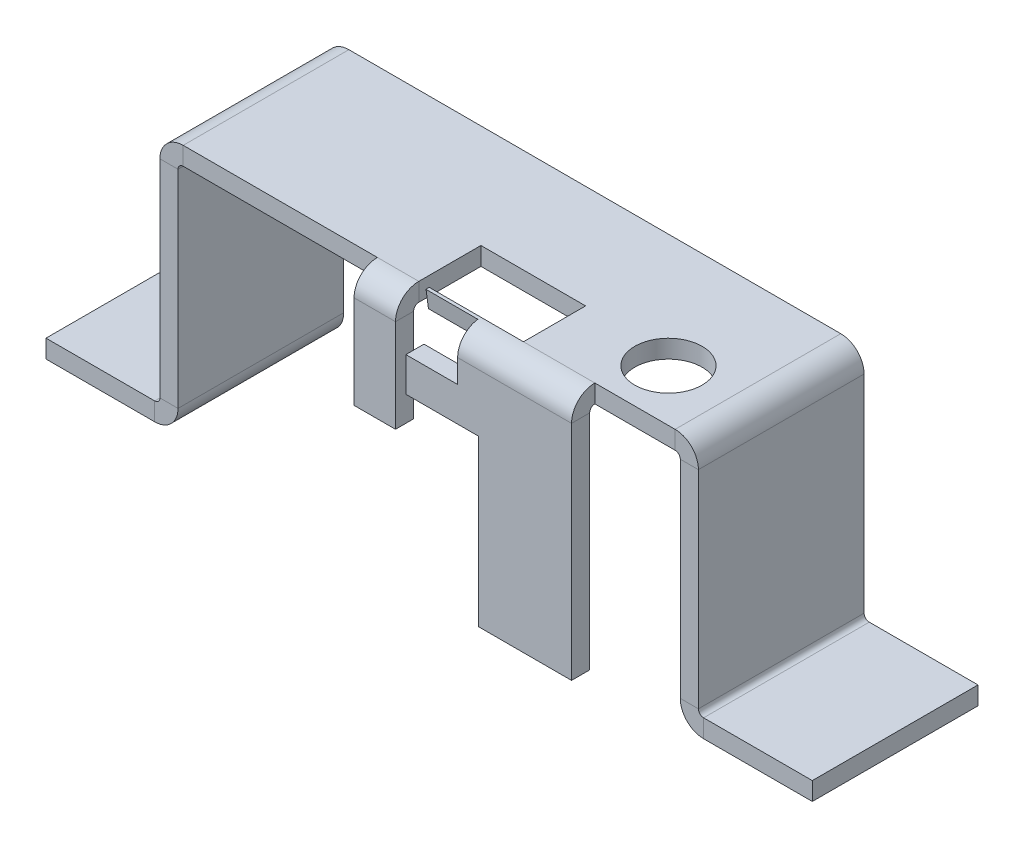
from build123d import *

# Parameters (mm, degrees)
SKETCH1_W               = 95
SKETCH1_H               = 32
BASE_FLANGE1_DEPTH      = 3.5
EDGE_FLANGE1_DEPTH      = 32
EDGE_FLANGE1_BEND_DEPTH = 32
EDGE_FLANGE2_DEPTH      = 32
EDGE_FLANGE2_BEND_DEPTH = 32
EDGE_FLANGE3_DEPTH      = 8
EDGE_FLANGE4_DEPTH      = 32
SKETCH30_R              = 6.5
SKETCH30_R_2            = 4
SKETCH30_W              = 20.215069336
SKETCH30_H              = 12
CUT_EXTRUDE1_DEPTH      = 10
CUT_EXTRUDE2_OUTLINE_W  = 31.867862703
CUT_EXTRUDE2_OUTLINE_H  = 3.5
CUT_EXTRUDE2_DEPTH      = 14
CUT_EXTRUDE2_2_DEPTH    = 10


# Read off the part's stored shape, not the designer's step: Cut-Extrude2
# Sheet-metal steps are written as plain solids
with BuildPart() as part:
    # Sketch1 → Base-Flange1 (new body)
    with BuildSketch(Plane(origin=(0, 0, 0), x_dir=(1, 0, 0), z_dir=(0, 1, 0))):
        Rectangle(SKETCH1_W, SKETCH1_H)
    extrude(amount=-BASE_FLANGE1_DEPTH)

    # Edge-Flange1 section (across the edge) → Edge-Flange1 (add)
    with BuildSketch(Plane(origin=(48.5, -3.5, -16), x_dir=(-1, 0, 0), z_dir=(0, 0, 1))):
        with BuildLine():
            Line((-3.5, 1), (-3.5, 41))
            Line((-3.5, 41), (0, 41))
            Line((0, 41), (0, 1))
            ThreePointArc((0, 1), (0.292893219, 0.292893219), (1, 0))
            Line((1, 0), (1, -3.5))
            ThreePointArc((1, -3.5), (-2.181980515, -2.181980515), (-3.5, 1))
        make_face()
    extrude(amount=EDGE_FLANGE1_DEPTH)

    # Edge-Flange1 section 2 (across the edge) → Edge-Flange1 bend (add)
    with BuildSketch(Plane(origin=(-48.5, -3.5, 16), x_dir=(1, 0, 0), z_dir=(0, 0, -1))):
        with BuildLine():
            Line((-3.5, 1), (-3.5, 41))
            Line((-3.5, 41), (0, 41))
            Line((0, 41), (0, 1))
            ThreePointArc((0, 1), (0.292893219, 0.292893219), (1, 0))
            Line((1, 0), (1, -3.5))
            ThreePointArc((1, -3.5), (-2.181980515, -2.181980515), (-3.5, 1))
        make_face()
    extrude(amount=EDGE_FLANGE1_BEND_DEPTH)

    # Edge-Flange2 section (across the edge) → Edge-Flange2 (add)
    with BuildSketch(Plane(origin=(52, -45.5, 16), x_dir=(0, 1, 0), z_dir=(0, 0, -1))):
        with BuildLine():
            Line((-3.5, 1), (-3.5, 22))
            Line((-3.5, 22), (0, 22))
            Line((0, 22), (0, 1))
            ThreePointArc((0, 1), (0.292893219, 0.292893219), (1, 0))
            Line((1, 0), (1, -3.5))
            ThreePointArc((1, -3.5), (-2.181980515, -2.181980515), (-3.5, 1))
        make_face()
    extrude(amount=EDGE_FLANGE2_DEPTH)

    # Edge-Flange2 section 2 (across the edge) → Edge-Flange2 bend (add)
    with BuildSketch(Plane(origin=(-52, -45.5, -16), x_dir=(0, 1, 0), z_dir=(0, 0, 1))):
        with BuildLine():
            Line((-3.5, 1), (-3.5, 22))
            Line((-3.5, 22), (0, 22))
            Line((0, 22), (0, 1))
            ThreePointArc((0, 1), (0.292893219, 0.292893219), (1, 0))
            Line((1, 0), (1, -3.5))
            ThreePointArc((1, -3.5), (-2.181980515, -2.181980515), (-3.5, 1))
        make_face()
    extrude(amount=EDGE_FLANGE2_BEND_DEPTH)

    # Edge-Flange3 section (across the edge) → Edge-Flange3 (add)
    with BuildSketch(Plane(origin=(-2, -3.5, 17), x_dir=(0, 0, -1), z_dir=(-1, 0, 0))):
        with BuildLine():
            Line((-3.5, 1), (-3.5, 19))
            Line((-3.5, 19), (0, 19))
            Line((0, 19), (0, 1))
            ThreePointArc((0, 1), (0.292893219, 0.292893219), (1, 0))
            Line((1, 0), (1, -3.5))
            ThreePointArc((1, -3.5), (-2.181980515, -2.181980515), (-3.5, 1))
        make_face()
    extrude(amount=EDGE_FLANGE3_DEPTH)

    # Edge-Flange4 section (across the edge) → Edge-Flange4 (add)
    with BuildSketch(Plane(origin=(32, -3.5, 17), x_dir=(0, 0, -1), z_dir=(-1, 0, 0))):
        with BuildLine():
            Line((-3.5, 1), (-3.5, 44))
            Line((-3.5, 44), (0, 44))
            Line((0, 44), (0, 1))
            ThreePointArc((0, 1), (0.292893219, 0.292893219), (1, 0))
            Line((1, 0), (1, -3.5))
            ThreePointArc((1, -3.5), (-2.181980515, -2.181980515), (-3.5, 1))
        make_face()
    extrude(amount=EDGE_FLANGE4_DEPTH)

    # Sketch30 → Cut-Extrude1 (cut)
    # profile 1 of 2: a face of its own
    with BuildSketch(Plane(origin=(0, 0, 0), x_dir=(1, 0, 0), z_dir=(0, 1, 0))):
        with Locations(Location((36.215069336, -6, 0), (0, 0, 270))):
            Circle(SKETCH30_R)
        with Locations((36.215069336, -6)):
            Circle(SKETCH30_R_2, mode=Mode.SUBTRACT)
    # profile 2 of 2: a face of its own
    with BuildSketch(Plane(origin=(0, 0, 0), x_dir=(1, 0, 0), z_dir=(0, 1, 0))):
        with Locations((8.107534668, -10)):
            Rectangle(SKETCH30_W, SKETCH30_H)
    extrude(amount=-CUT_EXTRUDE1_DEPTH, mode=Mode.SUBTRACT)


with BuildPart() as cut_extrude1_kept_piece:
    # of the separate pieces the step leaves, the one the design keeps (cut_extrude1_pieces_kept)
    add(part.part.solids().sort_by_distance((-47.5, -3.5, -16))[0])

    # Cut-Extrude2 outline → Cut-Extrude2 (cut)
    with BuildSketch(Plane.YZ):
        with Locations((-31.566068648, 18.75)):
            Rectangle(CUT_EXTRUDE2_OUTLINE_W, CUT_EXTRUDE2_OUTLINE_H)
    extrude(amount=CUT_EXTRUDE2_DEPTH, mode=Mode.SUBTRACT)

    # Cut-Extrude2 2 outline → Cut-Extrude2 2 (cut)
    with BuildSketch(Plane.YZ):
        with BuildLine():
            Line((-9, 20.5), (-9, 17))
            Line((-9, 17), (-4.5, 17))
            ThreePointArc((-4.5, 17), (-3.841719411, 16.752772652), (-3.50892875, 16.133333333))
            Line((-3.50892875, 16.133333333), (-0.040179376, 16.6))
            ThreePointArc((-0.040179376, 16.6), (-1.537737352, 19.387476937), (-4.5, 20.5))
            Line((-4.5, 20.5), (-9, 20.5))
        make_face()
    extrude(amount=CUT_EXTRUDE2_2_DEPTH, mode=Mode.SUBTRACT)


solid = cut_extrude1_kept_piece.part
